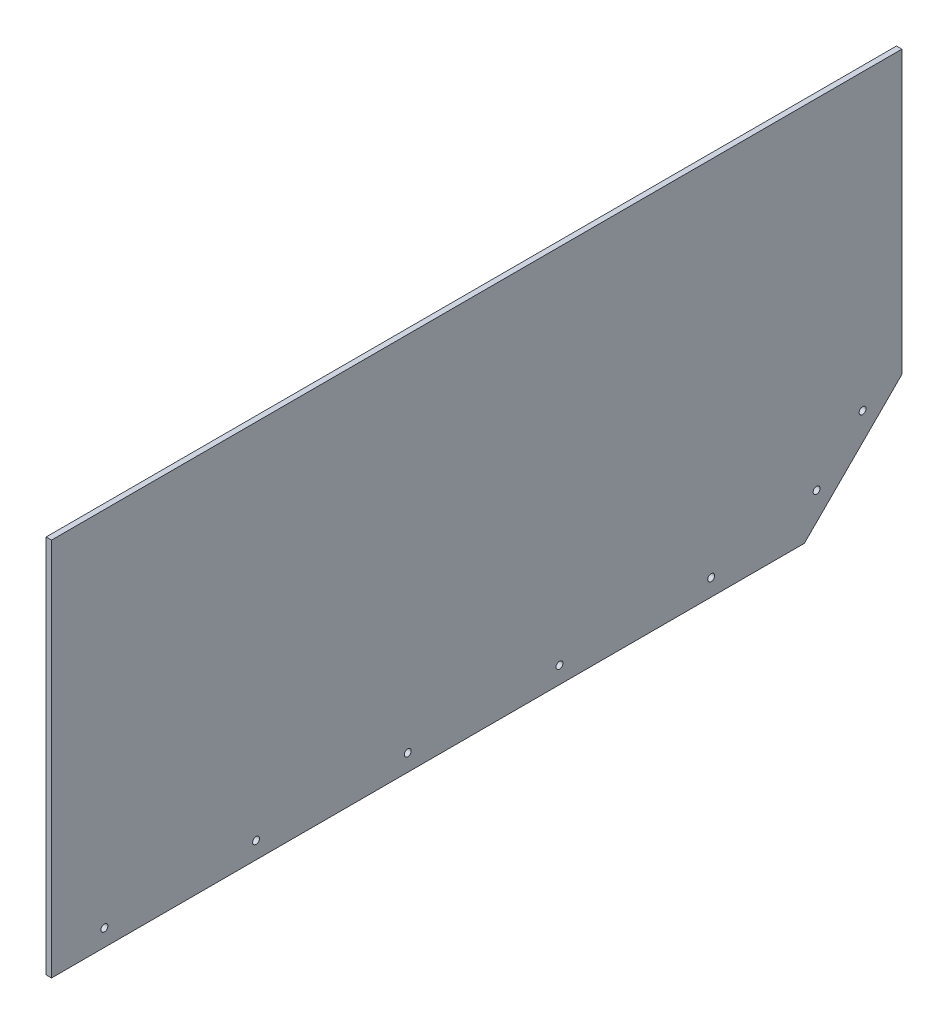
from build123d import *

# Parameters (mm, degrees)
SKETCH1_W           = 498.348
SKETCH1_H           = 165.1
BOSS_EXTRUDE1_DEPTH = 1.5875
BOSS_EXTRUDE2_DEPTH = 3.175
SKETCH3_R           = 2.025
CUT_EXTRUDE1_DEPTH  = 3.175
LPATTERN1_COUNT     = 5
LPATTERN1_PITCH     = 88.9
CUT_EXTRUDE2_DEPTH  = 286.681383539
LPATTERN2_COUNT     = 2
LPATTERN2_PITCH     = 38.1


with BuildPart() as part:
    # Sketch1 → Boss-Extrude1 (new, symmetric)
    with BuildSketch(Plane(origin=(0, 0, 0), x_dir=(0, 0, -1), z_dir=(1, 0, 0))):
        Rectangle(SKETCH1_W, SKETCH1_H)
    extrude(amount=BOSS_EXTRUDE1_DEPTH, both=True)

    # Sketch2 → Boss-Extrude2 (add)
    with BuildSketch(Plane(origin=(1.5875, 0, 0), x_dir=(0, 0, -1), z_dir=(1, 0, 0))):
        Polygon((-249.174, -139.7), (192.024, -139.7), (249.174, -82.55), (-249.174, -82.55), align=None)
    extrude(amount=-BOSS_EXTRUDE2_DEPTH)

    # Sketch3 → Cut-Extrude1 (cut)
    with BuildSketch(Plane(origin=(1.5875, 0, 0), x_dir=(0, 0, -1), z_dir=(1, 0, 0))):
        with Locations((-218.186, -129.794)):
            Circle(SKETCH3_R)
    cut_extrude1 = extrude(amount=-CUT_EXTRUDE1_DEPTH, mode=Mode.SUBTRACT)

    # LPattern1: Cut-Extrude1 ×5
    with Locations(*[(0, 0, -i * LPATTERN1_PITCH) for i in range(1, LPATTERN1_COUNT)]):
        add(cut_extrude1, mode=Mode.SUBTRACT)

    # Sketch4 → Cut-Extrude2 (cut, through all)
    with BuildSketch(Plane(origin=(1.5875, 0, 0), x_dir=(0, 0, -1), z_dir=(1, 0, 0))):
        with BuildLine():
            ThreePointArc((197.776313665, -117.783225317), (199.983138847, -118.222190139), (201.233204897, -116.351334085))
            ThreePointArc((201.233204897, -116.351334085), (198.433270946, -114.480478032), (197.776313665, -117.783225317))
        make_face()
    cut_extrude2 = extrude(amount=-CUT_EXTRUDE2_DEPTH, mode=Mode.SUBTRACT)

    # LPattern2: Cut-Extrude2 ×2
    with Locations(*[Vector(0, 0.7071067811865489, -0.7071067811865461) * (i * LPATTERN2_PITCH) for i in range(1, LPATTERN2_COUNT)]):
        add(cut_extrude2, mode=Mode.SUBTRACT)


solid = part.part
